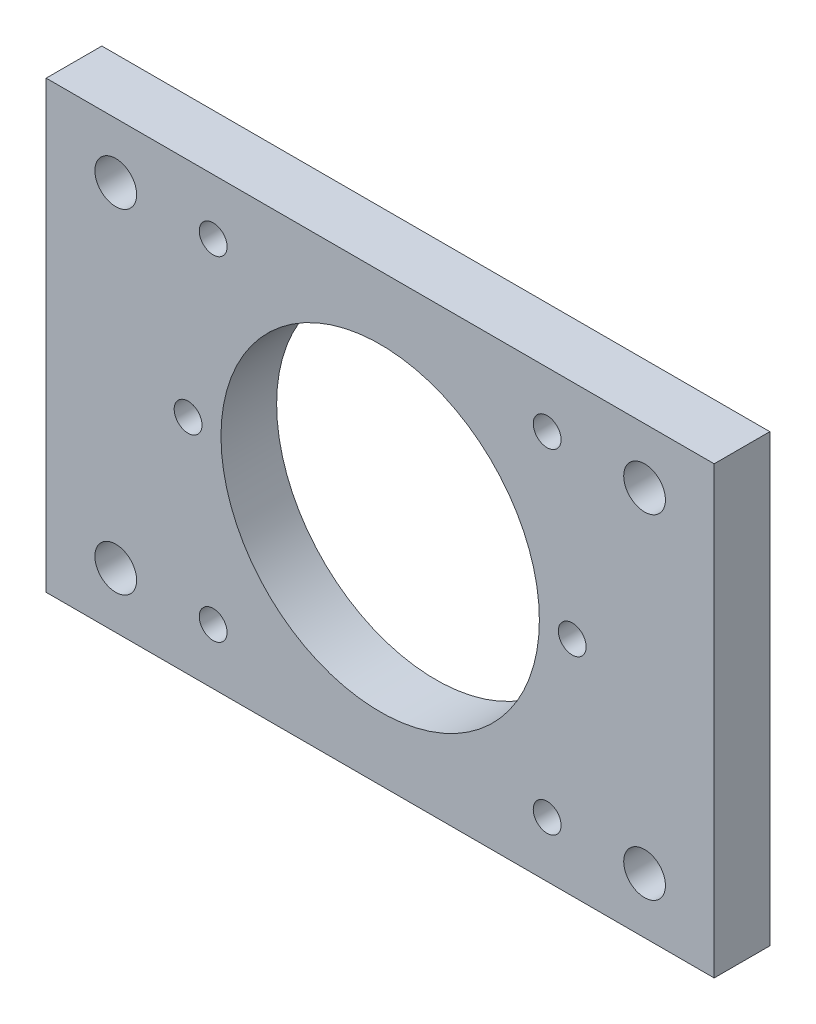
from build123d import *

# Parameters (mm, degrees)
SKETCH1_W               = 76.2
SKETCH1_H               = 50.8
BOSS_EXTRUDE1_DEPTH     = 6.35
CAVITY5_OUTLINE_R       = 18.161
CAVITY5_OUTLINE_R_2     = 1.5875
CAVITY5_DEPTH           = 6.35
SKETCH3_R               = 2.38125
CUT_EXTRUDE1_DEPTH      = 92.800885072
MIRROR2_COPY_1_SKETCH_R = 2.38125
MIRROR2_COPY_1_DEPTH    = 92.800885072
SKETCH4_R               = 1.5875
CUT_EXTRUDE2_DEPTH      = 92.800885072


# Read off the part's stored shape, not the designer's step: Cavity5
with BuildPart() as part:
    # Sketch1 → Boss-Extrude1 (new body)
    with BuildSketch(Plane.XY):
        with Locations((38.1, 25.4)):
            Rectangle(SKETCH1_W, SKETCH1_H)
    extrude(amount=BOSS_EXTRUDE1_DEPTH)

    # Cavity5 outline → Cavity5 (cut)
    with BuildSketch(Plane.XY):
        with Locations((38.1, 25.4)):
            Circle(CAVITY5_OUTLINE_R)
        with Locations((16.188175065, 25.4)):
            Circle(CAVITY5_OUTLINE_R_2)
        with Locations((60.011824935, 25.4)):
            Circle(CAVITY5_OUTLINE_R_2)
    extrude(amount=CAVITY5_DEPTH, mode=Mode.SUBTRACT)

    # Sketch3 → Cut-Extrude1 (cut, through all)
    with BuildSketch(Plane(origin=(0, 0, 0), x_dir=(-1, 0, 0), z_dir=(0, 0, -1))):
        with Locations((-68.2625, 44.45)):
            Circle(SKETCH3_R)
    cut_extrude1 = extrude(amount=-CUT_EXTRUDE1_DEPTH, mode=Mode.SUBTRACT)

    # Mirror1: Cut-Extrude1 across plane
    add(cut_extrude1.mirror(Plane(origin=(38.1, 0, 0), x_dir=(0, 0, 1), z_dir=(1, 0, 0))), mode=Mode.SUBTRACT)

    # Mirror2: Cut-Extrude1 across plane
    add(cut_extrude1.mirror(Plane.ZX.offset(25.4)), mode=Mode.SUBTRACT)

    # Mirror2 copy 1 sketch → Mirror2 copy 1 (cut, through all)
    with BuildSketch(Plane(origin=(76.2, 50.8, 0), x_dir=(1, 0, 0), z_dir=(0, 0, -1))):
        with Locations((-68.2625, 44.45)):
            Circle(MIRROR2_COPY_1_SKETCH_R)
    extrude(amount=-MIRROR2_COPY_1_DEPTH, mode=Mode.SUBTRACT)

    # Sketch4 → Cut-Extrude2 (cut, through all)
    with BuildSketch(Plane(origin=(0, 0, 0), x_dir=(-1, 0, 0), z_dir=(0, 0, -1))):
        with Locations((-19.05, 6.35)):
            Circle(SKETCH4_R)
        with Locations((-57.15, 6.35)):
            Circle(SKETCH4_R)
        with Locations((-19.05, 44.45)):
            Circle(SKETCH4_R)
        with Locations((-57.15, 44.45)):
            Circle(SKETCH4_R)
    extrude(amount=-CUT_EXTRUDE2_DEPTH, mode=Mode.SUBTRACT)


solid = part.part
